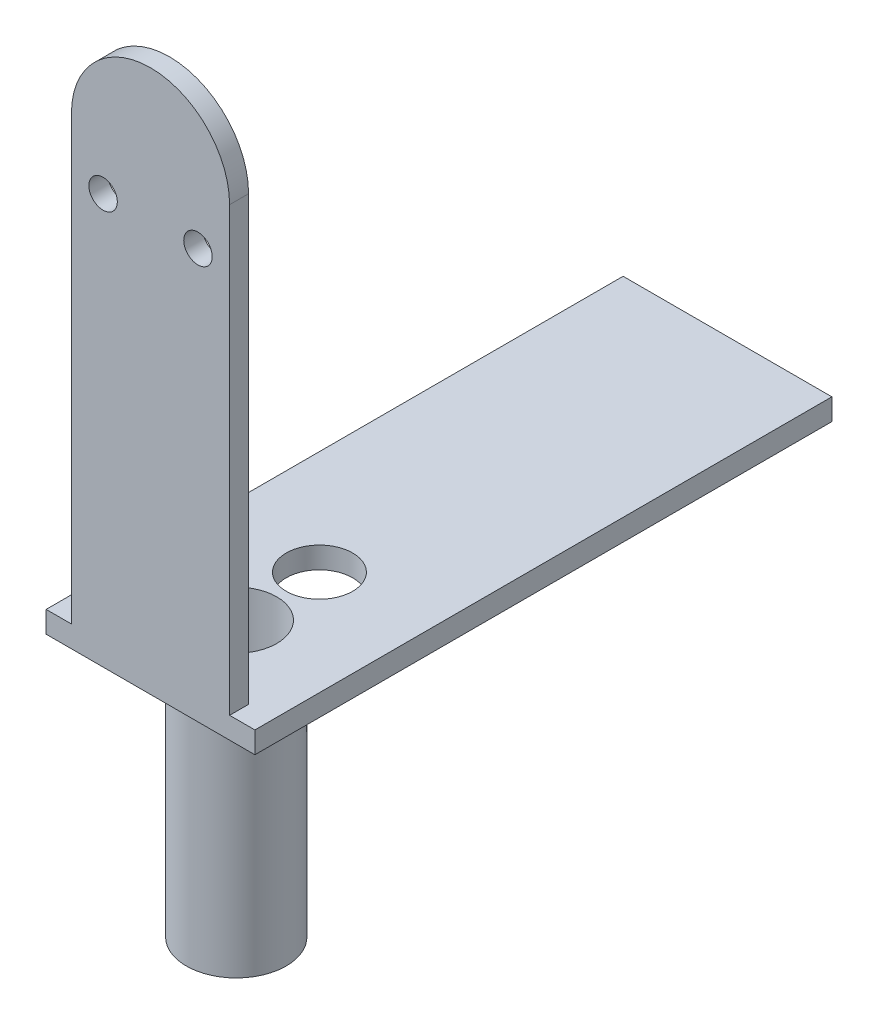
from build123d import *

# Parameters (mm, degrees)
SKETCH1_W            = 4
SKETCH1_H            = 80.5
BOSS_EXTRUDE1_DEPTH  = 71
BOSS_EXTRUDE2_START  = -4
BOSS_EXTRUDE2_DEPTH  = 4
BOSS_EXTRUDE3_DEPTH  = 34.2
CUT_EXTRUDE1_DEPTH   = 13
CUT_EXTRUDE2_DEPTH   = 13
SKETCH6_R            = 1.7
CUT_EXTRUDE3_DEPTH   = 13
SKETCH7_R            = 3.25
CUT_EXTRUDE4_DEPTH   = 2.5
BOSS_EXTRUDE4_DEPTH  = 44.5
SKETCH10_W           = 46.002383675
SKETCH10_H           = 61.711229379
CUT_EXTRUDE5_DEPTH   = 42
FILLET1_R            = 18
BOSS_EXTRUDE5_DEPTH  = 4
FILLET3_R            = 16.2
FILLET4_R            = 14
CUT_EXTRUDE6_DEPTH   = 10.6
BOSS_EXTRUDE6_START  = 4
BOSS_EXTRUDE6_DEPTH  = 4
CUT_EXTRUDE7_DEPTH   = 148
BOSS_EXTRUDE7_DEPTH  = 3
CUT_EXTRUDE8_DEPTH   = 14
SKETCH17_R           = 2.25
CUT_EXTRUDE9_DEPTH   = 14
SKETCH18_W           = 25
SKETCH18_H           = 92.2
BOSS_EXTRUDE8_DEPTH  = 4
SKETCH19_W           = 4
SKETCH19_H           = 92.2
BOSS_EXTRUDE9_DEPTH  = 4
SKETCH20_R           = 5.25
CUT_EXTRUDE10_DEPTH  = 4
SKETCH21_W           = 33
SKETCH21_H           = 92.2
CUT_EXTRUDE11_DEPTH  = 0.6
SKETCH22_R           = 5.25
CUT_EXTRUDE12_DEPTH  = 3.4
BOSS_EXTRUDE10_DEPTH = 40
SKETCH24_R           = 6.4
CUT_EXTRUDE13_DEPTH  = 3.4
BOSS_EXTRUDE11_DEPTH = 15
SKETCH26_W           = 10
SKETCH26_H           = 1.5
BOSS_EXTRUDE12_DEPTH = 15
CUT_EXTRUDE14_DEPTH  = 15
SKETCH28_W           = 33
SKETCH28_H           = 3.4
CUT_EXTRUDE15_DEPTH  = 1


with BuildPart() as part:
    # Sketch1 → Boss-Extrude1 (new body)
    with BuildSketch(Plane.XY):
        with Locations((2, 40.25)):
            Rectangle(SKETCH1_W, SKETCH1_H)
        with BuildLine():
            Line((0, 80.5), (4, 80.5))
            ThreePointArc((4, 80.5), (16.5, 93), (29, 80.5))
            Line((29, 80.5), (33, 80.5))
            ThreePointArc((33, 80.5), (16.5, 97), (0, 80.5))
        make_face()
        with Locations((31, 40.25)):
            Rectangle(SKETCH1_W, SKETCH1_H)
    extrude(amount=BOSS_EXTRUDE1_DEPTH)

    # Sketch2 → Boss-Extrude2 (add)
    with BuildSketch(Plane.XY.offset(71).offset(BOSS_EXTRUDE2_START)):
        with BuildLine():
            Line((33, 48.5), (0, 48.5))
            Line((0, 48.5), (0, 80.5))
            ThreePointArc((0, 80.5), (16.5, 97), (33, 80.5))
            Line((33, 80.5), (33, 48.5))
        make_face()
    extrude(amount=BOSS_EXTRUDE2_DEPTH)

    # Sketch3 → Boss-Extrude3 (add)
    with BuildSketch(Plane(origin=(0, 0, 67), x_dir=(-1, 0, 0), z_dir=(0, 0, -1))):
        Polygon((-33, 0), (-33, 48.5), (-29, 48.5), (-4, 48.5), (0, 48.5), (0, 0), (-3.837905566, 0), (-4, 44.5), (-29, 44.5), (-29.162094434, 0), align=None)
    extrude(amount=-BOSS_EXTRUDE3_DEPTH)

    # Sketch4 → Cut-Extrude1 (cut)
    with BuildSketch(Plane(origin=(0, 0, 0), x_dir=(-1, 0, 0), z_dir=(0, 0, -1))):
        with BuildLine():
            Line((-4, 80.5), (-4, 0))
            Line((-4, 0), (0, 0))
            Line((0, 0), (0, 80.5))
            ThreePointArc((0, 80.5), (-16.5, 97), (-33, 80.5))
            Line((-33, 80.5), (-33, 0))
            Line((-33, 0), (-29, 0))
            Line((-29, 0), (-29, 80.5))
            ThreePointArc((-29, 80.5), (-16.5, 93), (-4, 80.5))
        make_face()
    extrude(amount=-CUT_EXTRUDE1_DEPTH, mode=Mode.SUBTRACT)

    # Sketch5 → Cut-Extrude2 (cut)
    with BuildSketch(Plane.XY.offset(71)):
        with BuildLine():
            ThreePointArc((26.5, 80.5), (16.5, 90.5), (6.5, 80.5))
            Line((6.5, 80.5), (26.5, 80.5))
        make_face()
        with BuildLine():
            Line((26.5, 80.5), (6.5, 80.5))
            ThreePointArc((6.5, 80.5), (16.5, 70.5), (26.5, 80.5))
        make_face()
    extrude(amount=-CUT_EXTRUDE2_DEPTH, mode=Mode.SUBTRACT)

    # Sketch6 → Cut-Extrude3 (cut)
    with BuildSketch(Plane.XY.offset(71)):
        with Locations((6.5, 70.5)):
            Circle(SKETCH6_R)
        with BuildLine():
            ThreePointArc((28.2, 70.5), (26.5, 72.2), (24.8, 70.5))
            Line((24.8, 70.5), (28.2, 70.5))
        make_face()
        with BuildLine():
            Line((28.2, 70.5), (24.8, 70.5))
            ThreePointArc((24.8, 70.5), (26.5, 68.8), (28.2, 70.5))
        make_face()
    extrude(amount=-CUT_EXTRUDE3_DEPTH, mode=Mode.SUBTRACT)

    # Sketch7 → Cut-Extrude4 (cut)
    with BuildSketch(Plane.XY.offset(71)):
        with Locations((6.5, 70.5)):
            Circle(SKETCH7_R)
        with Locations((26.5, 70.5)):
            Circle(SKETCH7_R)
    extrude(amount=-CUT_EXTRUDE4_DEPTH, mode=Mode.SUBTRACT)

    # Sketch9 → Boss-Extrude4 (add)
    with BuildSketch(Plane.XZ):
        Polygon((29.162094434, 101.2), (29.162094434, 71), (29, 71), (29, 120), align=None)
        Polygon((4, 120), (3.837905566, 101.2), (3.837905566, 71), (4, 71), align=None)
    extrude(amount=-BOSS_EXTRUDE4_DEPTH)

    # Sketch10 → Cut-Extrude5 (cut)
    with BuildSketch(Plane.XY.offset(101.2)):
        with Locations((17.24268837, 24.291112106)):
            Rectangle(SKETCH10_W, SKETCH10_H)
    extrude(amount=CUT_EXTRUDE5_DEPTH, mode=Mode.SUBTRACT)

    # Fillet1
    fillet1_edges = [part.edges().sort_by_distance(p)[0] for p in [
        (16.5, 48.5, 71),
        (16.5, 44.5, 67),
    ]]
    fillet(fillet1_edges, radius=FILLET1_R)

    # Sketch11 → Boss-Extrude5 (add)
    with BuildSketch(Plane.XY.offset(101.2)):
        Polygon((29, 0), (4, 0), (0, 0), (0, 48.5), (33, 48.5), (33, 0), align=None)
    extrude(amount=BOSS_EXTRUDE5_DEPTH)

    # Fillet3
    fillet3_edges = [part.edges().sort_by_distance(p)[0] for p in [
        (16.5, 48.5, 105.2),
    ]]
    fillet(fillet3_edges, radius=FILLET3_R - 0.0001)  # a hair under: the kernel refuses the full size

    # Fillet4
    fillet4_edges = [part.edges().sort_by_distance(p)[0] for p in [
        (16.5, 44.5, 101.2),
    ]]
    fillet(fillet4_edges, radius=FILLET4_R)

    # Sketch12 → Cut-Extrude6 (cut)
    with BuildSketch(Plane.XZ):
        Polygon((4, 13), (4, 101.2), (29, 101.2), (29, 13), (33, 13), (33, 105.2), (0, 105.2), (0, 13), align=None)
    extrude(amount=-CUT_EXTRUDE6_DEPTH, mode=Mode.SUBTRACT)

    # Sketch13 → Boss-Extrude6 (add)
    with BuildSketch(Plane(origin=(0, 0, 13), x_dir=(-1, 0, 0), z_dir=(0, 0, -1)).offset(BOSS_EXTRUDE6_START)):
        with BuildLine():
            Line((-33, 80.5), (-33, 10.6))
            Line((-33, 10.6), (-29, 10.6))
            Line((-29, 10.6), (-29, 80.5))
            ThreePointArc((-29, 80.5), (-16.5, 93), (-4, 80.5))
            Line((-4, 80.5), (-4, 10.6))
            Line((-4, 10.6), (0, 10.6))
            Line((0, 10.6), (0, 80.5))
            ThreePointArc((0, 80.5), (-16.5, 97), (-33, 80.5))
        make_face()
    extrude(amount=-BOSS_EXTRUDE6_DEPTH)

    # Sketch14 → Cut-Extrude7 (cut)
    with BuildSketch(Plane(origin=(0, 0, 13), x_dir=(-1, 0, 0), z_dir=(0, 0, -1))):
        with BuildLine():
            Line((-29, 10.6), (-4, 10.6))
            Line((-4, 10.6), (0, 10.6))
            Line((0, 10.6), (0, 80.5))
            ThreePointArc((0, 80.5), (-16.5, 97), (-33, 80.5))
            Line((-33, 80.5), (-33, 10.6))
            Line((-33, 10.6), (-29, 10.6))
        make_face()
    extrude(amount=-CUT_EXTRUDE7_DEPTH, mode=Mode.SUBTRACT)

    # Sketch16 → Cut-Extrude8 (cut)
    with BuildSketch(Plane(origin=(0, 0, 9), x_dir=(-1, 0, 0), z_dir=(0, 0, -1))):
        with BuildLine():
            Line((-33, 80.5), (-33, 10.6))
            Line((-33, 10.6), (-29, 10.6))
            Line((-29, 10.6), (-29, 80.5))
            ThreePointArc((-29, 80.5), (-16.5, 93), (-4, 80.5))
            Line((-4, 80.5), (-4, 10.6))
            Line((-4, 10.6), (0, 10.6))
            Line((0, 10.6), (0, 80.5))
            ThreePointArc((0, 80.5), (-16.5, 97), (-33, 80.5))
        make_face()
    extrude(amount=-CUT_EXTRUDE8_DEPTH, mode=Mode.SUBTRACT)


with BuildPart() as body_2:
    # Sketch15 → Boss-Extrude7 (new body)
    with BuildSketch(Plane.XY.offset(13)):
        with BuildLine():
            Line((4, 10.6), (29, 10.6))
            Line((29, 10.6), (29, 80.5))
            ThreePointArc((29, 80.5), (16.5, 93), (4, 80.5))
            Line((4, 80.5), (4, 10.6))
        make_face()
    extrude(amount=BOSS_EXTRUDE7_DEPTH)

    # Sketch17 → Cut-Extrude9 (cut)
    with BuildSketch(Plane(origin=(0, 0, 13), x_dir=(-1, 0, 0), z_dir=(0, 0, -1))):
        with Locations((-24, 72)):
            Circle(SKETCH17_R)
        with Locations((-9, 72)):
            Circle(SKETCH17_R)
    extrude(amount=-CUT_EXTRUDE9_DEPTH, mode=Mode.SUBTRACT)

    # Sketch18 → Boss-Extrude8 (add)
    with BuildSketch(Plane.XZ.offset(-10.6)):
        with Locations((16.5, -30.1)):
            Rectangle(SKETCH18_W, SKETCH18_H)
    extrude(amount=BOSS_EXTRUDE8_DEPTH)

    # Sketch19 → Boss-Extrude9 (add)
    with BuildSketch(Plane.XZ.offset(-6.6)):
        with Locations((2, -30.1)):
            Rectangle(SKETCH19_W, SKETCH19_H)
        with Locations((31, -30.1)):
            Rectangle(SKETCH19_W, SKETCH19_H)
    extrude(amount=-BOSS_EXTRUDE9_DEPTH)

    # Sketch20 → Cut-Extrude10 (cut)
    with BuildSketch(Plane.XZ.offset(-6.6)):
        with Locations(Location((16.5, -10.7, 0), (0, 0, 270))):
            Circle(SKETCH20_R)
    extrude(amount=-CUT_EXTRUDE10_DEPTH, mode=Mode.SUBTRACT)

    # Sketch21 → Cut-Extrude11 (cut)
    with BuildSketch(Plane.XZ.offset(-6.6)):
        with Locations((16.5, -30.1)):
            Rectangle(SKETCH21_W, SKETCH21_H)
    extrude(amount=-CUT_EXTRUDE11_DEPTH, mode=Mode.SUBTRACT)

    # Sketch22 → Cut-Extrude12 (cut)
    with BuildSketch(Plane.XZ.offset(-7.2)):
        with Locations(Location((16.5, 1.3, 0), (0, 0, 270))):
            Circle(SKETCH22_R)
    extrude(amount=-CUT_EXTRUDE12_DEPTH, mode=Mode.SUBTRACT)

    # Sketch23 → Boss-Extrude10 (add)
    with BuildSketch(Plane.XZ.offset(-7.2)):
        with BuildLine():
            ThreePointArc((16.5, 10.35), (8.6, 2.45), (16.5, -5.45))
            Line((16.5, -5.45), (16.5, -3.95))
            ThreePointArc((16.5, -3.95), (10.1, 2.45), (16.5, 8.85))
            Line((16.5, 8.85), (16.5, 10.35))
        make_face()
        with BuildLine():
            Line((16.5, -3.95), (16.5, -5.45))
            ThreePointArc((16.5, -5.45), (22.086143571, -3.136143571), (24.4, 2.45))
            ThreePointArc((24.4, 2.45), (22.086143571, 8.036143571), (16.5, 10.35))
            Line((16.5, 10.35), (16.5, 8.85))
            ThreePointArc((16.5, 8.85), (21.0254834, 6.9754834), (22.9, 2.45))
            ThreePointArc((22.9, 2.45), (21.0254834, -2.0754834), (16.5, -3.95))
        make_face()
    extrude(amount=BOSS_EXTRUDE10_DEPTH)

    # Sketch24 → Cut-Extrude13 (cut)
    with BuildSketch(Plane.XZ.offset(-7.2)):
        with Locations(Location((16.5, 2.45, 0), (0, 0, 270))):
            Circle(SKETCH24_R)
    extrude(amount=-CUT_EXTRUDE13_DEPTH, mode=Mode.SUBTRACT)

    # Sketch25 → Boss-Extrude11 (add)
    with BuildSketch(Plane(origin=(0, 10.6, 0), x_dir=(1, 0, 0), z_dir=(0, 1, 0))):
        Polygon((26.5, 72.7), (6.5, 72.7), (6.5, 74.7), (16.5, 74.7), (26.5, 74.7), align=None)
    extrude(amount=BOSS_EXTRUDE11_DEPTH)

    # Sketch26 → Boss-Extrude12 (add)
    with BuildSketch(Plane(origin=(0, 10.6, 0), x_dir=(1, 0, 0), z_dir=(0, 1, 0))):
        with Locations((16.5, 75.45)):
            Rectangle(SKETCH26_W, SKETCH26_H)
    extrude(amount=BOSS_EXTRUDE12_DEPTH)

    # Sketch27 → Cut-Extrude14 (cut)
    with BuildSketch(Plane(origin=(0, 10.6, 0), x_dir=(1, 0, 0), z_dir=(0, 1, 0))):
        Polygon((6.5, 72.7), (26.5, 72.7), (26.5, 74.7), (21.5, 74.7), (21.5, 76.2), (11.5, 76.2), (11.5, 74.7), (6.5, 74.7), align=None)
    extrude(amount=CUT_EXTRUDE14_DEPTH, mode=Mode.SUBTRACT)

    # Sketch28 → Cut-Extrude15 (cut)
    with BuildSketch(Plane(origin=(0, 0, -76.2), x_dir=(-1, 0, 0), z_dir=(0, 0, -1))):
        with Locations((-16.5, 8.9)):
            Rectangle(SKETCH28_W, SKETCH28_H)
    extrude(amount=-CUT_EXTRUDE15_DEPTH, mode=Mode.SUBTRACT)


solid = body_2.part
